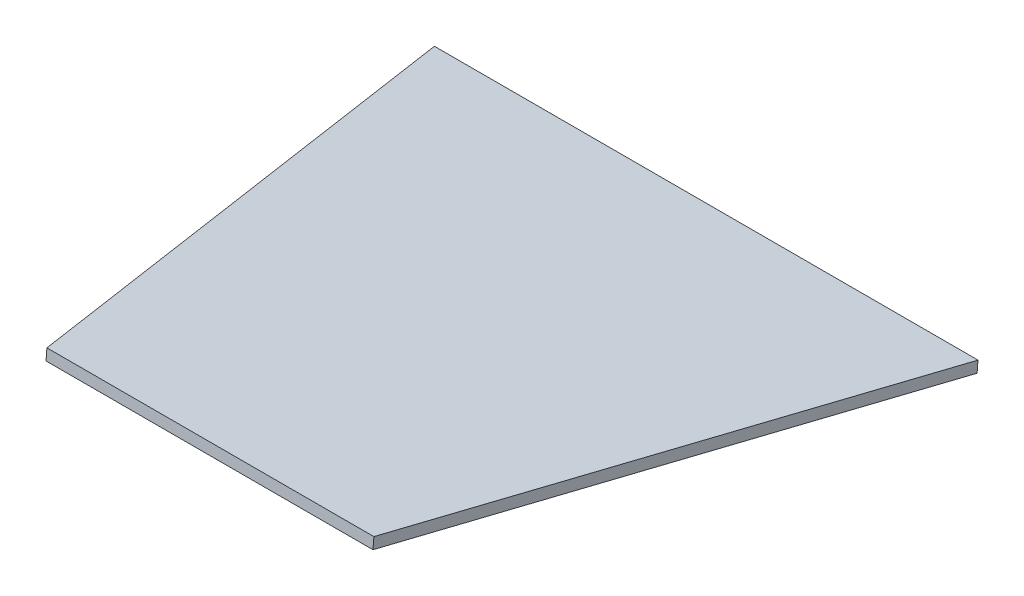
from build123d import *

# Parameters (mm, degrees)
BOSS_EXTRUDE1_DEPTH = 12.7


with BuildPart() as part:
    # Sketch1 → Boss-Extrude1 (new body)
    with BuildSketch(Plane(origin=(-0.000252854, -3154.555162014, 260.230195415), x_dir=(-0.9999999999999969, 7.961414168714261e-08, -6.567661367452003e-09), z_dir=(-7.988457756299226e-08, -0.9966146823530273, 0.08221420143970512))):
        Polygon((927.93235892, -1893.28840213), (1306.839320039, -1893.28840213), (1432.352062767, -1316.739819061), (802.419616192, -1316.739819061), align=None)
    extrude(amount=BOSS_EXTRUDE1_DEPTH)


solid = part.part
